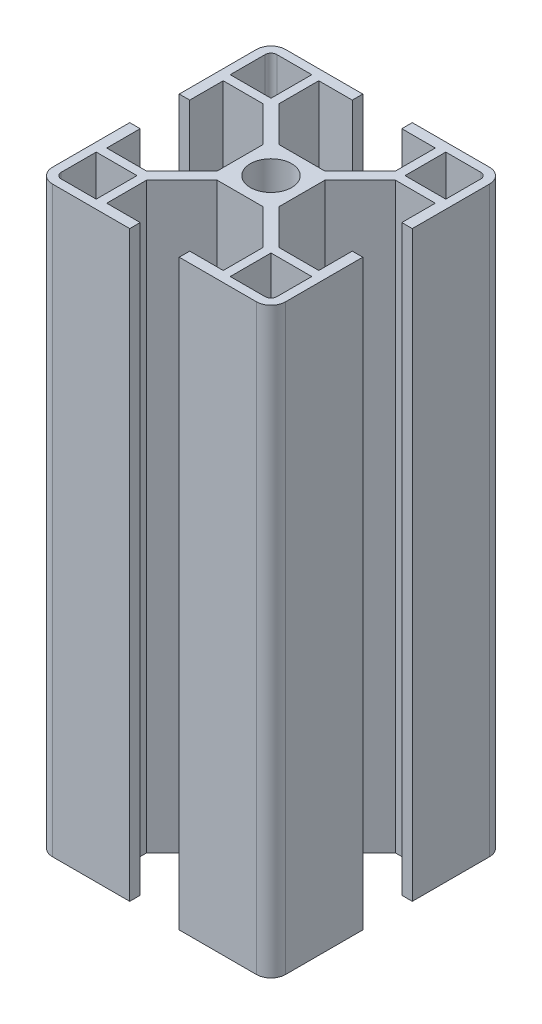
from build123d import *

# Parameters (mm, degrees)
SKETCH_1_R      = 3.55
SKETCH_1_W      = 7
SKETCH_1_H      = 7
EXTRUDE_1_DEPTH = 100
FILLET_1_R      = 1
FILLET_2_R      = 2.5


with BuildPart() as part:
    # 草图1 → 凸台-拉伸1 (new body)
    with BuildSketch(Plane(origin=(0, 0, 0), x_dir=(1, 0, 0), z_dir=(0, 1, 0))):
        Polygon((-20, 20), (-4.25, 20), (-4.25, 18.2), (-10, 18.2), (-10, 11.343502884), (-3.956497116, 5.3), (3.956497116, 5.3), (10, 11.343502884), (10, 18.2), (4.25, 18.2), (4.25, 20), (20, 20), (20, 4.25), (18.2, 4.25), (18.2, 10), (11.343502884, 10), (5.3, 3.956497116), (5.3, -3.956497116), (11.343502884, -10), (18.2, -10), (18.2, -4.25), (20, -4.25), (20, -20), (4.25, -20), (4.25, -18.2), (10, -18.2), (10, -11.343502884), (3.956497116, -5.3), (-3.956497116, -5.3), (-10, -11.343502884), (-10, -18.2), (-4.25, -18.2), (-4.25, -20), (-20, -20), (-20, -4.25), (-18.2, -4.25), (-18.2, -10), (-11.343502884, -10), (-5.3, -3.956497116), (-5.3, 3.956497116), (-11.343502884, 10), (-18.2, 10), (-18.2, 4.25), (-20, 4.25), align=None)
        Circle(SKETCH_1_R, mode=Mode.SUBTRACT)
        with Locations((-15, 15)):
            Rectangle(SKETCH_1_W, SKETCH_1_H, mode=Mode.SUBTRACT)
        with Locations((15, 15)):
            Rectangle(SKETCH_1_W, SKETCH_1_H, mode=Mode.SUBTRACT)
        with Locations((15, -15)):
            Rectangle(SKETCH_1_W, SKETCH_1_H, mode=Mode.SUBTRACT)
        with Locations((-15, -15)):
            Rectangle(SKETCH_1_W, SKETCH_1_H, mode=Mode.SUBTRACT)
    extrude(amount=EXTRUDE_1_DEPTH)

    # 圆角1
    fillet_1_edges = [part.edges().sort_by_distance(p)[0] for p in [
        (18.5, 50, -18.5),
        (-18.5, 50, -18.5),
        (-18.5, 50, 18.5),
        (18.5, 50, 18.5),
    ]]
    fillet(fillet_1_edges, radius=FILLET_1_R)

    # 圆角2
    fillet_2_edges = [part.edges().sort_by_distance(p)[0] for p in [
        (-20, 50, 20),
        (20, 50, 20),
        (20, 50, -20),
        (-20, 50, -20),
    ]]
    fillet(fillet_2_edges, radius=FILLET_2_R)


solid = part.part
